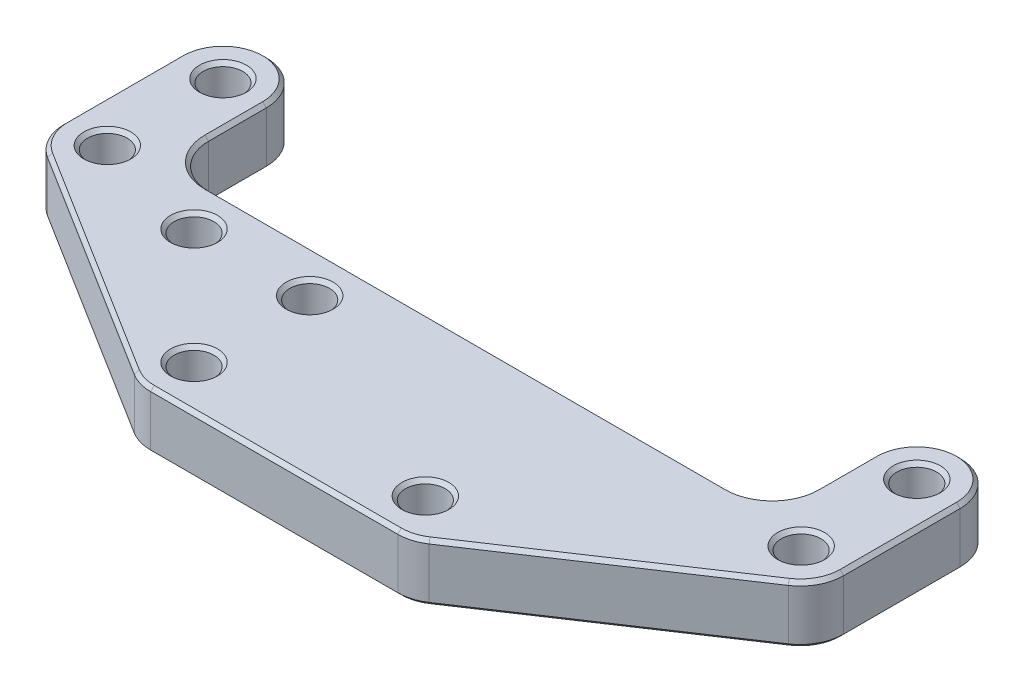
from build123d import *

# Parameters (mm, degrees)
SKETCH1_R           = 2.1828125
BOSS_EXTRUDE1_DEPTH = 3.175
FILLET1_R           = 4.7625
CHAMFER1_SIZE       = 0.396875


with BuildPart() as part:
    # Sketch1 → Boss-Extrude1 (new, symmetric)
    with BuildSketch(Plane(origin=(0, 0, 0), x_dir=(1, 0, 0), z_dir=(0, 1, 0))):
        Polygon((-33.3375, 7.9375), (-33.3375, 23.8125), (-42.8625, 23.8125), (-42.8625, 3.710395607), (-14.065867028, -14.2875), (15.876245853, -14.2875), (42.8625, 3.710395607), (42.8625, 23.8125), (33.3375, 23.8125), (33.3375, 7.9375), align=None)
        with Locations(Location((-38.1, 6.35, 0), (0, 0, 270))):
            Circle(SKETCH1_R, mode=Mode.SUBTRACT)
        with Locations(Location((-38.1, 19.05, 0), (0, 0, 270))):
            Circle(SKETCH1_R, mode=Mode.SUBTRACT)
        with Locations(Location((38.1, 19.05, 0), (0, 0, 270))):
            Circle(SKETCH1_R, mode=Mode.SUBTRACT)
        with Locations(Location((38.1, 6.35, 0), (0, 0, 270))):
            Circle(SKETCH1_R, mode=Mode.SUBTRACT)
        with Locations(Location((-25.4, 3.175, 0), (0, 0, 270))):
            Circle(SKETCH1_R, mode=Mode.SUBTRACT)
        with Locations(Location((-12.7, 3.175, 0), (0, 0, 270))):
            Circle(SKETCH1_R, mode=Mode.SUBTRACT)
        with Locations(Location((-12.7, -9.525, 0), (0, 0, 270))):
            Circle(SKETCH1_R, mode=Mode.SUBTRACT)
        with Locations(Location((12.7, -9.525, 0), (0, 0, 270))):
            Circle(SKETCH1_R, mode=Mode.SUBTRACT)
    extrude(amount=BOSS_EXTRUDE1_DEPTH, both=True)

    # Fillet1
    fillet1_edges = [part.edges().sort_by_distance(p)[0] for p in [
        (42.8625, 0, -3.710395607),
        (15.876245853, 0, 14.2875),
        (-14.065867028, 0, 14.2875),
        (-42.8625, 0, -3.710395607),
        (-33.3375, 0, -23.8125),
        (-42.8625, 0, -23.8125),
        (42.8625, 0, -23.8125),
        (33.3375, 0, -23.8125),
        (33.3375, 0, -7.9375),
        (-33.3375, 0, -7.9375),
    ]]
    fillet(fillet1_edges, radius=FILLET1_R - 0.0001)  # a hair under: the kernel refuses the full size

    # Chamfer1
    chamfer1_edges = [part.edges().sort_by_distance(p)[0] for p in [
        (-38.1, -3.175, -8.5328125),
        (-38.1, 3.175, -8.5328125),
        (-38.1, -3.175, -21.2328125),
        (-38.1, 3.175, -21.2328125),
        (38.1, -3.175, -21.2328125),
        (38.1, 3.175, -21.2328125),
        (38.1, -3.175, -8.5328125),
        (38.1, 3.175, -8.5328125),
        (-12.7, -3.175, -5.3578125),
        (-12.7, 3.175, -5.3578125),
        (-25.4, -3.175, -5.3578125),
        (-25.4, 3.175, -5.3578125),
        (12.7, -3.175, 7.3421875),
        (12.7, 3.175, 7.3421875),
        (-12.7, -3.175, 7.3421875),
        (-12.7, 3.175, 7.3421875),
        (42.8625, -3.175, -12.654350033),
        (42.8625, 3.175, -12.654350033),
        (28.909389934, -3.175, 5.595327855),
        (0.866903869, -3.175, 14.2875),
        (-27.924131292, -3.175, 5.626084835),
        (-42.8625, -3.175, -12.700022288),
        (-33.3375, -3.175, -15.875),
        (0, -3.175, -7.9375),
        (33.3375, -3.175, -15.875),
        (34.732374665, -3.175, -22.417625335),
        (41.467625335, -3.175, -22.417625335),
        (-41.467625335, -3.175, -22.417625335),
        (-34.732374665, -3.175, -22.417625335),
        (-42.265497353, -3.175, -4.041282917),
        (-14.01293908, -3.175, 14.102951029),
        (15.814317137, -3.175, 14.083030095),
        (42.299190555, -3.175, -4.011804065),
        (28.909389934, 3.175, 5.595327855),
        (33.3375, 3.175, -15.875),
        (0, 3.175, -7.9375),
        (-33.3375, 3.175, -15.875),
        (-42.8625, 3.175, -12.700022288),
        (-27.924131292, 3.175, 5.626084835),
        (0.866903869, 3.175, 14.2875),
        (34.732374665, 3.175, -22.417625335),
        (41.467625335, 3.175, -22.417625335),
        (-41.467625335, 3.175, -22.417625335),
        (-34.732374665, 3.175, -22.417625335),
        (-42.265497353, 3.175, -4.041282917),
        (-14.01293908, 3.175, 14.102951029),
        (15.814317137, 3.175, 14.083030095),
        (42.299190555, 3.175, -4.011804065),
        (31.942625335, -3.175, -9.332374665),
        (31.942625335, 3.175, -9.332374665),
        (-31.942625335, -3.175, -9.332374665),
        (-31.942625335, 3.175, -9.332374665),
    ]]
    chamfer(chamfer1_edges, length=CHAMFER1_SIZE)


solid = part.part
